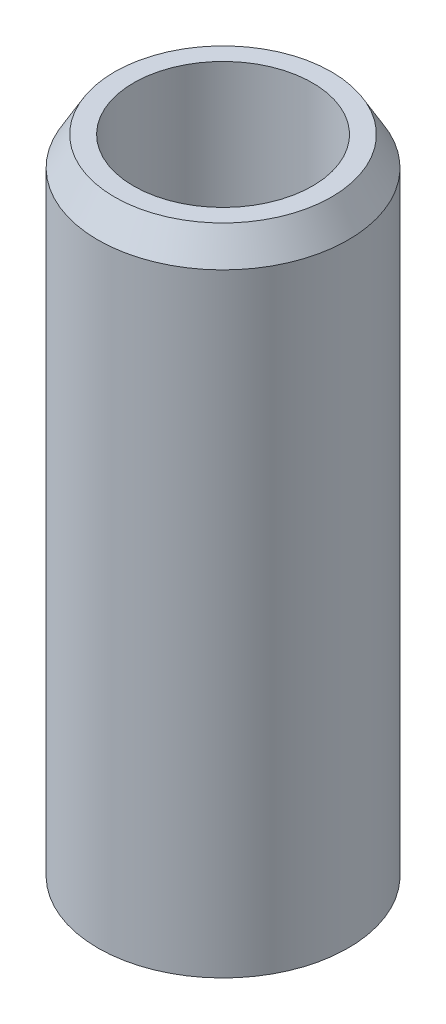
from build123d import *
from OCP.BRepFilletAPI import BRepFilletAPI_MakeChamfer

# Parameters (mm, degrees)
SKETCH1_R           = 25
BOSS_EXTRUDE1_DEPTH = 131.607697526
SKETCH2_R           = 17.870121383
CUT_EXTRUDE1_DEPTH  = 137.273937523
CHAMFER1_SIZE       = 5.763927206
CHAMFER1_SIZE2      = 3.327804924


with BuildPart() as part:
    # Sketch1 → Boss-Extrude1 (new body)
    with BuildSketch(Plane(origin=(0, 0, 0), x_dir=(1, 0, 0), z_dir=(0, 1, 0))):
        Circle(SKETCH1_R)
    extrude(amount=BOSS_EXTRUDE1_DEPTH)

    # Sketch2 → Cut-Extrude1 (cut, through all)
    with BuildSketch(Plane(origin=(0, 0, 0), x_dir=(1, 0, 0), z_dir=(0, 1, 0))):
        Circle(SKETCH2_R)
    extrude(amount=CUT_EXTRUDE1_DEPTH, mode=Mode.SUBTRACT)

    # Chamfer1: one chamfer whose edges measure the first distance from different faces: ONE call of the kernel's chamfer builder (chamfer() names one face for all edges)
    chamfer1_edges_1 = [part.edges().sort_by_distance(p)[0] for p in [
        (-25, 131.607697526, 0),
    ]]
    chamfer1_side_1 = [part.faces().sort_by_distance(p)[0] for p in [
        (-25, 65.803848763, 0),
    ]]
    chamfer1_edges_2 = [part.edges().sort_by_distance(p)[0] for p in [
        (-25, 0, 0),
    ]]
    chamfer1_side_2 = [part.faces().sort_by_distance(p)[0] for p in [
        (-24.292893219, 0, 0),
    ]]
    chamfer1 = BRepFilletAPI_MakeChamfer(part.part.solid().wrapped)
    for e in chamfer1_edges_1:
        chamfer1.Add(CHAMFER1_SIZE, CHAMFER1_SIZE2, e.wrapped, chamfer1_side_1[0].wrapped)  # the first distance lies on this face
    for e in chamfer1_edges_2:
        chamfer1.Add(CHAMFER1_SIZE, CHAMFER1_SIZE2, e.wrapped, chamfer1_side_2[0].wrapped)  # the first distance lies on this face
    add(Compound.cast(chamfer1.Shape()), mode=Mode.REPLACE)


solid = part.part
